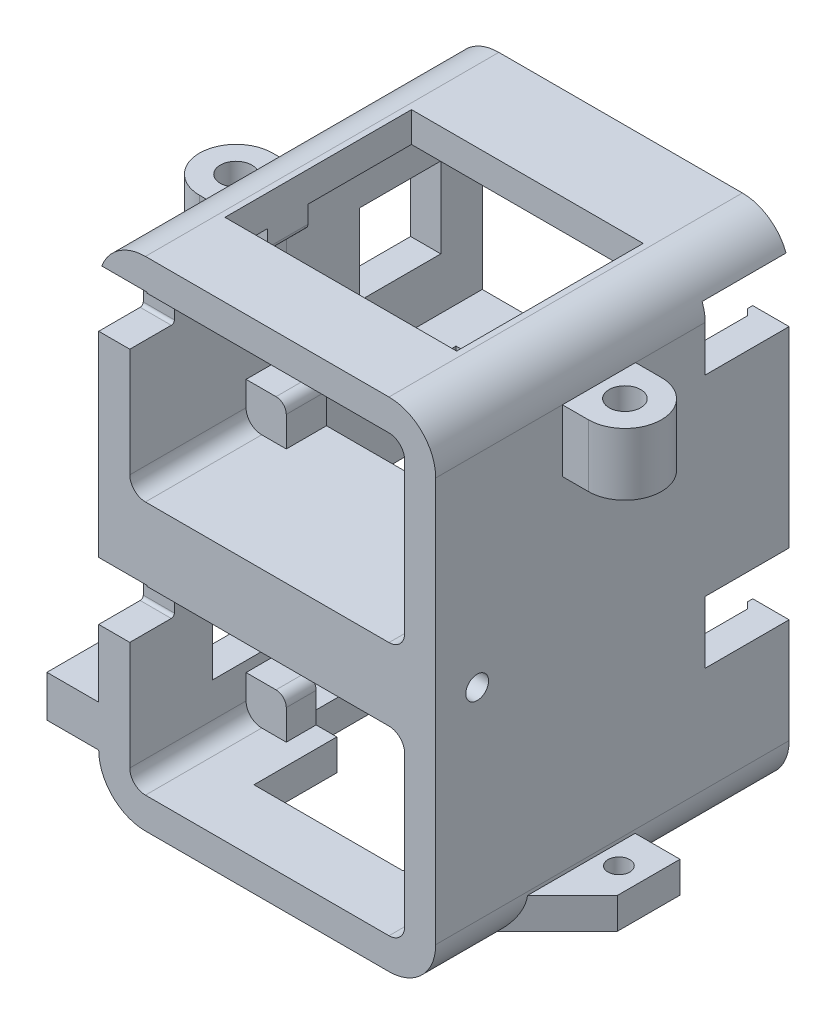
from build123d import *

# Parameters (mm, degrees)
EXTRUDE_2_DEPTH      = 11.22
EXTRUDE_3_DEPTH      = 3.88
CUT_EXTRUDE_1_DEPTH  = 4.65
SKETCH_8_R           = 3.525
SKETCH_8_R_2         = 1.525
EXTRUDE_5_DEPTH      = 6
SKETCH_9_W           = 22.36
SKETCH_9_H           = 3
CUT_EXTRUDE_3_DEPTH  = 8
SKETCH_10_W          = 21.46
SKETCH_10_H          = 6.88
CUT_EXTRUDE_4_DEPTH  = 1
CUT_EXTRUDE_5_DEPTH  = 8
EXTRUDE_7_DEPTH      = 3
SKETCH_15_W          = 26.7
SKETCH_15_H          = 42.2
EXTRUDE_17822_DEPTH  = 19
SKETCH_16_W          = 26.7
SKETCH_16_H          = 6.8
EXTRUDE_9_DEPTH      = 16
CUT_EXTRUDE_8_REACH  = 51.099
SKETCH_17_W          = 19.76
SKETCH_17_H          = 10
CUT_EXTRUDE_9_REACH  = 63.216
SKETCH_18_W          = 8.1
SKETCH_18_H          = 6
CUT_EXTRUDE_START    = -2.91
SKETCH_19_W          = 21.46
SKETCH_19_H          = 1
SKETCH_19_H_2        = 10
CUT_EXTRUDE_10_DEPTH = 2.91
CUT_EXTRUDE_14_REACH = 64.971
SKETCH_24_W          = 14
SKETCH_24_H          = 8
CUT_EXTRUDE_11_REACH = 64.971
SKETCH_20_W          = 22.36
SKETCH_20_H          = 10
SKETCH_21_W          = 1.5
SKETCH_21_H          = 5
EXTRUDE_10_DEPTH     = 0.6
CHAMFER_1_SIZE       = 1
CUT_EXTRUDE_12_REACH = 64.955
SKETCH_22_W          = 15
SKETCH_22_H          = 9.56
SKETCH_22_W_2        = 7.1
SKETCH_22_W_3        = 7.859919518
SKETCH_22_H_2        = 7.76
CUT_EXTRUDE_13_REACH = 64.971
SKETCH_23_W          = 0.38
SKETCH_23_H          = 8
SKETCH_25_R          = 1.05
EXTRUDE_24505_DEPTH  = 3
SKETCH_26_W          = 5
SKETCH_26_H          = 4
EXTRUDE_12_DEPTH     = 7
SKETCH_27_R          = 1.05
CUT_EXTRUDE_15_DEPTH = 57.74919682


with BuildPart() as part:
    # 草图2 → 凸台-拉伸2 (new body)
    with BuildSketch(Plane.XY):
        with BuildLine():
            ThreePointArc((-16.26, -7.25), (-14.939051583, -10.439051583), (-11.75, -11.76))
            Line((-11.75, -11.76), (11.75, -11.76))
            ThreePointArc((11.75, -11.76), (14.939051583, -10.439051583), (16.26, -7.25))
            Line((16.26, -7.25), (16.26, 31.75))
            ThreePointArc((16.26, 31.75), (14.939051583, 34.939051583), (11.75, 36.26))
            Line((11.75, 36.26), (-11.75, 36.26))
            ThreePointArc((-11.75, 36.26), (-14.939051583, 34.939051583), (-16.26, 31.75))
            Line((-16.26, 31.75), (-16.26, -7.25))
        make_face()
        with BuildLine():
            Line((13.26, 7.25), (13.26, -7.25))
            ThreePointArc((13.26, -7.25), (12.81773124, -8.31773124), (11.75, -8.76))
            Line((11.75, -8.76), (-11.75, -8.76))
            ThreePointArc((-11.75, -8.76), (-12.81773124, -8.31773124), (-13.26, -7.25))
            Line((-13.26, -7.25), (-13.26, 7.25))
            ThreePointArc((-13.26, 7.25), (-12.81773124, 8.31773124), (-11.75, 8.76))
            Line((-11.75, 8.76), (11.75, 8.76))
            ThreePointArc((11.75, 8.76), (12.81773124, 8.31773124), (13.26, 7.25))
        make_face(mode=Mode.SUBTRACT)
        with BuildLine():
            Line((-11.75, 33.26), (11.75, 33.26))
            ThreePointArc((11.75, 33.26), (12.81773124, 32.81773124), (13.26, 31.75))
            Line((13.26, 31.75), (13.26, 17.25))
            ThreePointArc((13.26, 17.25), (12.81773124, 16.18226876), (11.75, 15.74))
            Line((11.75, 15.74), (-11.75, 15.74))
            ThreePointArc((-11.75, 15.74), (-12.81773124, 16.18226876), (-13.26, 17.25))
            Line((-13.26, 17.25), (-13.26, 31.75))
            ThreePointArc((-13.26, 31.75), (-12.81773124, 32.81773124), (-11.75, 33.26))
        make_face(mode=Mode.SUBTRACT)
    extrude(amount=-EXTRUDE_2_DEPTH)

    # 草图3 → 凸台-拉伸3 (add)
    with BuildSketch(Plane(origin=(0, 0, -11.22), x_dir=(-1, 0, 0), z_dir=(0, 0, -1))):
        with BuildLine():
            ThreePointArc((11.75, -11.76), (14.939051583, -10.439051583), (16.26, -7.25))
            Line((16.26, -7.25), (16.26, 31.75))
            ThreePointArc((16.26, 31.75), (14.939051583, 34.939051583), (11.75, 36.26))
            Line((11.75, 36.26), (-11.75, 36.26))
            ThreePointArc((-11.75, 36.26), (-14.939051583, 34.939051583), (-16.26, 31.75))
            Line((-16.26, 31.75), (-16.26, -7.25))
            ThreePointArc((-16.26, -7.25), (-14.939051583, -10.439051583), (-11.75, -11.76))
            Line((-11.75, -11.76), (11.75, -11.76))
        make_face()
        with BuildLine():
            Line((13.26, -4.88), (10.37, -4.88))
            ThreePointArc((10.37, -4.88), (9.669964287, -5.169964287), (9.38, -5.87))
            Line((9.38, -5.87), (9.38, -8.76))
            Line((9.38, -8.76), (-9.38, -8.76))
            Line((-9.38, -8.76), (-9.38, -5.87))
            ThreePointArc((-9.38, -5.87), (-9.669964287, -5.169964287), (-10.37, -4.88))
            Line((-10.37, -4.88), (-13.26, -4.88))
            Line((-13.26, -4.88), (-13.26, 6.68))
            Line((-13.26, 6.68), (-11.67, 6.68))
            ThreePointArc((-11.67, 6.68), (-11.323517677, 6.823517677), (-11.18, 7.17))
            Line((-11.18, 7.17), (-11.18, 8.76))
            Line((-11.18, 8.76), (11.18, 8.76))
            Line((11.18, 8.76), (11.18, 7.17))
            ThreePointArc((11.18, 7.17), (11.323517677, 6.823517677), (11.67, 6.68))
            Line((11.67, 6.68), (13.26, 6.68))
            Line((13.26, 6.68), (13.26, -4.88))
        make_face(mode=Mode.SUBTRACT)
        with BuildLine():
            Line((13.26, 31.18), (13.26, 19.62))
            Line((13.26, 19.62), (10.37, 19.62))
            ThreePointArc((10.37, 19.62), (9.669964287, 19.330035713), (9.38, 18.63))
            Line((9.38, 18.63), (9.38, 15.74))
            Line((9.38, 15.74), (-9.38, 15.74))
            Line((-9.38, 15.74), (-9.38, 18.63))
            ThreePointArc((-9.38, 18.63), (-9.669964287, 19.330035713), (-10.37, 19.62))
            Line((-10.37, 19.62), (-13.26, 19.62))
            Line((-13.26, 19.62), (-13.26, 31.18))
            Line((-13.26, 31.18), (-11.67, 31.18))
            ThreePointArc((-11.67, 31.18), (-11.323517677, 31.323517677), (-11.18, 31.67))
            Line((-11.18, 31.67), (-11.18, 33.26))
            Line((-11.18, 33.26), (11.18, 33.26))
            Line((11.18, 33.26), (11.18, 31.67))
            ThreePointArc((11.18, 31.67), (11.323517677, 31.323517677), (11.67, 31.18))
            Line((11.67, 31.18), (13.26, 31.18))
        make_face(mode=Mode.SUBTRACT)
    extrude(amount=EXTRUDE_3_DEPTH)

    # 草图4 → 切除-拉伸1 (cut)
    with BuildSketch(Plane.ZY.offset(16.26)):
        with BuildLine():
            Line((0.1, 8.85), (-4, 8.85))
            ThreePointArc((-4, 8.85), (-4.212132034, 8.762132034), (-4.3, 8.55))
            Line((-4.3, 8.55), (-4.3, 3.55))
            ThreePointArc((-4.3, 3.55), (-4.212132034, 3.337867966), (-4, 3.25))
            Line((-4, 3.25), (0.1, 3.25))
            Line((0.1, 3.25), (0.1, 8.85))
        make_face()
        with BuildLine():
            Line((0.1, 33.35), (-4, 33.35))
            ThreePointArc((-4, 33.35), (-4.212132034, 33.262132034), (-4.3, 33.05))
            Line((-4.3, 33.05), (-4.3, 28.05))
            ThreePointArc((-4.3, 28.05), (-4.212132034, 27.837867966), (-4, 27.75))
            Line((-4, 27.75), (0.1, 27.75))
            Line((0.1, 27.75), (0.1, 33.35))
        make_face()
    extrude(amount=-CUT_EXTRUDE_1_DEPTH, mode=Mode.SUBTRACT)

    # 草图8 → 凸台-拉伸5 (add)
    # profile 1 of 3: a face of its own
    with BuildSketch(Plane(origin=(0, 31.75, 0), x_dir=(1, 0, 0), z_dir=(0, 1, 0))):
        with Locations((18.76, 15.755)):
            Circle(SKETCH_8_R)
        with Locations(Location((18.76, 15.755, 0), (0, 0, 270))):
            Circle(SKETCH_8_R_2, mode=Mode.SUBTRACT)
    # profile 2 of 3: a face of its own
    with BuildSketch(Plane(origin=(0, 31.75, 0), x_dir=(1, 0, 0), z_dir=(0, 1, 0))):
        with BuildLine():
            Line((15.235, 19.28), (15.235, 15.755))
            ThreePointArc((15.235, 15.755), (16.267448596, 18.247551404), (18.76, 19.28))
            Line((18.76, 19.28), (15.235, 19.28))
        make_face()
    # profile 3 of 3: a face of its own
    with BuildSketch(Plane(origin=(0, 31.75, 0), x_dir=(1, 0, 0), z_dir=(0, 1, 0))):
        with BuildLine():
            Line((15.235, 12.23), (18.76, 12.23))
            ThreePointArc((18.76, 12.23), (16.267448596, 13.262448596), (15.235, 15.755))
            Line((15.235, 15.755), (15.235, 12.23))
        make_face()
    extrude_5 = extrude(amount=-EXTRUDE_5_DEPTH)

    # 镜向1: 凸台-拉伸5 across plane
    add(extrude_5.mirror(Plane(origin=(0, 0, 0), x_dir=(0, 0, 1), z_dir=(1, 0, 0))))

    # 草图9 → 切除-拉伸3 (cut)
    with BuildSketch(Plane(origin=(0, 0, -15.1), x_dir=(-1, 0, 0), z_dir=(0, 0, -1))):
        with Locations((0, 34.76)):
            Rectangle(SKETCH_9_W, SKETCH_9_H)
    extrude(amount=-CUT_EXTRUDE_3_DEPTH, mode=Mode.SUBTRACT)

    # 草图10 → 切除-拉伸4 (cut)
    with BuildSketch(Plane(origin=(0, 0, -15.1), x_dir=(-1, 0, 0), z_dir=(0, 0, -1))):
        with Locations((0, -8.32)):
            Rectangle(SKETCH_10_W, SKETCH_10_H)
    extrude(amount=-CUT_EXTRUDE_4_DEPTH, mode=Mode.SUBTRACT)

    # 草图12 → 切除-拉伸5 (cut)
    with BuildSketch(Plane.ZY.offset(16.26)):
        with BuildLine():
            ThreePointArc((-2.9, 12.25), (-4, 13.35), (-5.1, 12.25))
            Line((-5.1, 12.25), (-2.9, 12.25))
        make_face()
        with BuildLine():
            Line((-2.9, 12.25), (-5.1, 12.25))
            ThreePointArc((-5.1, 12.25), (-4, 11.15), (-2.9, 12.25))
        make_face()
    cut_extrude_5 = extrude(amount=-CUT_EXTRUDE_5_DEPTH, mode=Mode.SUBTRACT)

    # 镜向2: 切除-拉伸5 across plane
    add(cut_extrude_5.mirror(Plane(origin=(0, 0, 0), x_dir=(0, 0, 1), z_dir=(1, 0, 0))), mode=Mode.SUBTRACT)

    # 草图14 → 凸台-拉伸7 (add)
    with BuildSketch(Plane(origin=(0, 0, -15.1), x_dir=(-1, 0, 0), z_dir=(0, 0, -1))):
        with BuildLine():
            Line((-16.26, 19.53), (-16.26, 8.85))
            Line((-16.26, 8.85), (-9.88, 8.85))
            Line((-9.88, 8.85), (-9.88, 19.490232527))
            ThreePointArc((-9.88, 19.490232527), (-9.918346198, 19.510970398), (-9.957568187, 19.53))
            Line((-9.957568187, 19.53), (-16.26, 19.53))
        make_face()
        with BuildLine():
            Line((9.88, 8.85), (16.26, 8.85))
            Line((16.26, 8.85), (16.26, 19.53))
            Line((16.26, 19.53), (9.957568187, 19.53))
            ThreePointArc((9.957568187, 19.53), (9.918346198, 19.510970398), (9.88, 19.490232527))
            Line((9.88, 19.490232527), (9.88, 8.85))
        make_face()
    extrude(amount=EXTRUDE_7_DEPTH)

    # 草图15 → Extrude 17822 (add)
    with BuildSketch(Plane(origin=(0, 0, -15.1), x_dir=(-1, 0, 0), z_dir=(0, 0, -1))):
        with BuildLine():
            Line((-16.26, 31.75), (-16.26, 19.53))
            Line((-16.26, 19.53), (-16.26, 8.85))
            Line((-16.26, 8.85), (-16.26, -7.25))
            ThreePointArc((-16.26, -7.25), (-14.939051583, -10.439051583), (-11.75, -11.76))
            Line((-11.75, -11.76), (11.75, -11.76))
            ThreePointArc((11.75, -11.76), (14.939051583, -10.439051583), (16.26, -7.25))
            Line((16.26, -7.25), (16.26, 8.85))
            Line((16.26, 8.85), (16.26, 19.53))
            Line((16.26, 19.53), (16.26, 31.75))
            ThreePointArc((16.26, 31.75), (14.939051583, 34.939051583), (11.75, 36.26))
            Line((11.75, 36.26), (-11.75, 36.26))
            ThreePointArc((-11.75, 36.26), (-14.939051583, 34.939051583), (-16.26, 31.75))
        make_face()
        with Locations((0, 12.25)):
            Rectangle(SKETCH_15_W, SKETCH_15_H, mode=Mode.SUBTRACT)
    extrude(amount=EXTRUDE_17822_DEPTH)

    # 草图16 → 凸台-拉伸9 (add)
    with BuildSketch(Plane(origin=(0, 0, -18.1), x_dir=(-1, 0, 0), z_dir=(0, 0, -1))):
        with Locations((0, 12.25)):
            Rectangle(SKETCH_16_W, SKETCH_16_H)
    extrude(amount=EXTRUDE_9_DEPTH)

    # 草图17 → 切除-拉伸8 (cut, up to next)
    with BuildSketch(Plane.XZ.offset(-8.85), mode=Mode.PRIVATE) as cut_extrude_8_sk1:
        with Locations((0, -23.1)):
            Rectangle(SKETCH_17_W, SKETCH_17_H)
    cut_extrude_8_tool1 = extrude(cut_extrude_8_sk1.sketch, amount=-CUT_EXTRUDE_8_REACH, mode=Mode.PRIVATE) & part.part
    add(cut_extrude_8_tool1.solids().sort_by_distance((0, 8.85, -23.1))[0], mode=Mode.SUBTRACT)

    # 草图18 → 切除-拉伸9 (cut, up to next)
    with BuildSketch(Plane.ZY.offset(-13.35), mode=Mode.PRIVATE) as cut_extrude_9_sk1:
        with Locations((-30.05, 5.85)):
            Rectangle(SKETCH_18_W, SKETCH_18_H)
    cut_extrude_9_tool1 = extrude(cut_extrude_9_sk1.sketch, amount=-CUT_EXTRUDE_9_REACH, mode=Mode.PRIVATE) & part.part
    # 草图18 → 切除-拉伸9 (cut, up to next)
    with BuildSketch(Plane.ZY.offset(-13.35), mode=Mode.PRIVATE) as cut_extrude_9_sk2:
        with Locations((-30.05, 30.35)):
            Rectangle(SKETCH_18_W, SKETCH_18_H)
    cut_extrude_9_tool2 = extrude(cut_extrude_9_sk2.sketch, amount=-CUT_EXTRUDE_9_REACH, mode=Mode.PRIVATE) & part.part
    add(cut_extrude_9_tool1.solids().sort_by_distance((13.35, 5.85, -30.05))[0], mode=Mode.SUBTRACT)
    add(cut_extrude_9_tool2.solids().sort_by_distance((13.35, 30.35, -30.05))[0], mode=Mode.SUBTRACT)

    # 草图19 → 切除-拉伸10 (cut)
    with BuildSketch(Plane.XZ.offset(11.76).offset(CUT_EXTRUDE_START)):
        with Locations((0, -14.6)):
            Rectangle(SKETCH_19_W, SKETCH_19_H)
        with Locations((0, -20.1)):
            Rectangle(SKETCH_19_W, SKETCH_19_H_2)
    extrude(amount=CUT_EXTRUDE_10_DEPTH, mode=Mode.SUBTRACT)

    # 草图24 → 切除-拉伸14 (cut, up to next)
    with BuildSketch(Plane.XZ.offset(11.76), mode=Mode.PRIVATE) as cut_extrude_14_sk1:
        with Locations((0, -10.1)):
            Rectangle(SKETCH_24_W, SKETCH_24_H)
    cut_extrude_14_tool1 = extrude(cut_extrude_14_sk1.sketch, amount=-CUT_EXTRUDE_14_REACH, mode=Mode.PRIVATE) & part.part
    add(cut_extrude_14_tool1.solids().sort_by_distance((0, -11.76, -10.1))[0], mode=Mode.SUBTRACT)

    # 草图20 → 切除-拉伸11 (cut, up to next)
    with BuildSketch(Plane(origin=(0, 36.26, 0), x_dir=(1, 0, 0), z_dir=(0, 1, 0)), mode=Mode.PRIVATE) as cut_extrude_11_sk1:
        with Locations((0, 20.1)):
            Rectangle(SKETCH_20_W, SKETCH_20_H)
    cut_extrude_11_tool1 = extrude(cut_extrude_11_sk1.sketch, amount=-CUT_EXTRUDE_11_REACH, mode=Mode.PRIVATE) & part.part
    add(cut_extrude_11_tool1.solids().sort_by_distance((0, 36.26, -20.1))[0], mode=Mode.SUBTRACT)

    # 草图21 → 凸台-拉伸10 (add)
    with BuildSketch(Plane.ZY.offset(-13.35)):
        with Locations((-33.35, 24.85)):
            Rectangle(SKETCH_21_W, SKETCH_21_H)
        with Locations((-33.35, 0.35)):
            Rectangle(SKETCH_21_W, SKETCH_21_H)
    extrude(amount=EXTRUDE_10_DEPTH)

    # 倒角1
    # the kernel refuses this chamfer: 1 mm, written as the material it takes off along each edge
    with BuildSketch(Plane(origin=(12.75, 5.421682988, -32.6), x_dir=(-0.02749587661058555, 0, -0.9996219169112968), z_dir=(0, -1, 0))) as chamfer_1_piece_1_section:
        Polygon((CHAMFER_1_SIZE * 0.999621916911, CHAMFER_1_SIZE * 0.0274958766106), (-CHAMFER_1_SIZE * 0.0274958766106, CHAMFER_1_SIZE * 0.999621916911), (0, 0), align=None)
    chamfer_1_piece_1 = extrude(amount=10.143365976, mode=Mode.PRIVATE)
    chamfer_1_piece_1 = split(chamfer_1_piece_1, bisect_by=Plane(origin=(13.35, 0.35, -32.97500946), z_dir=(-1, 0, 0)), keep=Keep.TOP, mode=Mode.PRIVATE)
    add(chamfer_1_piece_1, mode=Mode.SUBTRACT)
    with BuildSketch(Plane(origin=(12.75, 29.921682988, -32.6), x_dir=(-0.02749587661058555, 0, -0.9996219169112968), z_dir=(0, -1, 0))) as chamfer_1_piece_2_section:
        Polygon((CHAMFER_1_SIZE * 0.999621916911, CHAMFER_1_SIZE * 0.0274958766106), (-CHAMFER_1_SIZE * 0.0274958766106, CHAMFER_1_SIZE * 0.999621916911), (0, 0), align=None)
    chamfer_1_piece_2 = extrude(amount=10.143365976, mode=Mode.PRIVATE)
    chamfer_1_piece_2 = split(chamfer_1_piece_2, bisect_by=Plane(origin=(13.35, 24.85, -32.97500946), z_dir=(-1, 0, 0)), keep=Keep.TOP, mode=Mode.PRIVATE)
    add(chamfer_1_piece_2, mode=Mode.SUBTRACT)

    # 草图22 → 切除-拉伸12 (cut, up to next)
    with BuildSketch(Plane.ZY.offset(16.26), mode=Mode.PRIVATE) as cut_extrude_12_sk1:
        with Locations((-22.6, 0.9)):
            Rectangle(SKETCH_22_W, SKETCH_22_H)
    cut_extrude_12_tool1 = extrude(cut_extrude_12_sk1.sketch, amount=-CUT_EXTRUDE_12_REACH, mode=Mode.PRIVATE) & part.part
    # 草图22 → 切除-拉伸12 (cut, up to next)
    with BuildSketch(Plane.ZY.offset(16.26), mode=Mode.PRIVATE) as cut_extrude_12_sk2:
        with Locations((-11.55, 0.9)):
            Rectangle(SKETCH_22_W_2, SKETCH_22_H)
    cut_extrude_12_tool2 = extrude(cut_extrude_12_sk2.sketch, amount=-CUT_EXTRUDE_12_REACH, mode=Mode.PRIVATE) & part.part
    # 草图22 → 切除-拉伸12 (cut, up to next)
    with BuildSketch(Plane.ZY.offset(16.26), mode=Mode.PRIVATE) as cut_extrude_12_sk3:
        with Locations((-26.170040241, 24.5)):
            Rectangle(SKETCH_22_W_3, SKETCH_22_H_2)
    cut_extrude_12_tool3 = extrude(cut_extrude_12_sk3.sketch, amount=-CUT_EXTRUDE_12_REACH, mode=Mode.PRIVATE) & part.part
    add(cut_extrude_12_tool1.solids().sort_by_distance((-16.26, 0.9, -22.6))[0], mode=Mode.SUBTRACT)
    add(cut_extrude_12_tool2.solids().sort_by_distance((-16.26, 0.9, -11.55))[0], mode=Mode.SUBTRACT)
    add(cut_extrude_12_tool3.solids().sort_by_distance((-16.26, 24.5, -26.17004))[0], mode=Mode.SUBTRACT)

    # 草图23 → 切除-拉伸13 (cut, up to next)
    with BuildSketch(Plane.XZ.offset(11.76), mode=Mode.PRIVATE) as cut_extrude_13_sk1:
        with Locations((-7.19, -10.1)):
            Rectangle(SKETCH_23_W, SKETCH_23_H)
    cut_extrude_13_tool1 = extrude(cut_extrude_13_sk1.sketch, amount=-CUT_EXTRUDE_13_REACH, mode=Mode.PRIVATE) & part.part
    add(cut_extrude_13_tool1.solids().sort_by_distance((-7.19, -11.76, -10.1))[0], mode=Mode.SUBTRACT)

    # 草图25 → Extrude 24505 (add)
    with BuildSketch(Plane(origin=(0, -10.58, 0), x_dir=(1, 0, 0), z_dir=(0, 1, 0))):
        Polygon((20.58, 19.255), (14.58, 19.255), (14.58, 7.205252532), (20.58, 13.205252532), align=None)
        with Locations(Location((18.18, 15.755, 0), (0, 0, 180))):
            Circle(SKETCH_25_R, mode=Mode.SUBTRACT)
    extrude(amount=EXTRUDE_24505_DEPTH)

    # 草图26 → 凸台-拉伸12 (add)
    with BuildSketch(Plane.XY):
        with Locations((-18.76, -5.25)):
            Rectangle(SKETCH_26_W, SKETCH_26_H)
    extrude(amount=-EXTRUDE_12_DEPTH)

    # 草图27 → 切除-拉伸15 (cut, through all)
    with BuildSketch(Plane(origin=(0, -3.25, 0), x_dir=(1, 0, 0), z_dir=(0, 1, 0))):
        with Locations(Location((-17.76, 3.5, 0), (0, 0, 180))):
            Circle(SKETCH_27_R)
    extrude(amount=-CUT_EXTRUDE_15_DEPTH, mode=Mode.SUBTRACT)


solid = part.part
